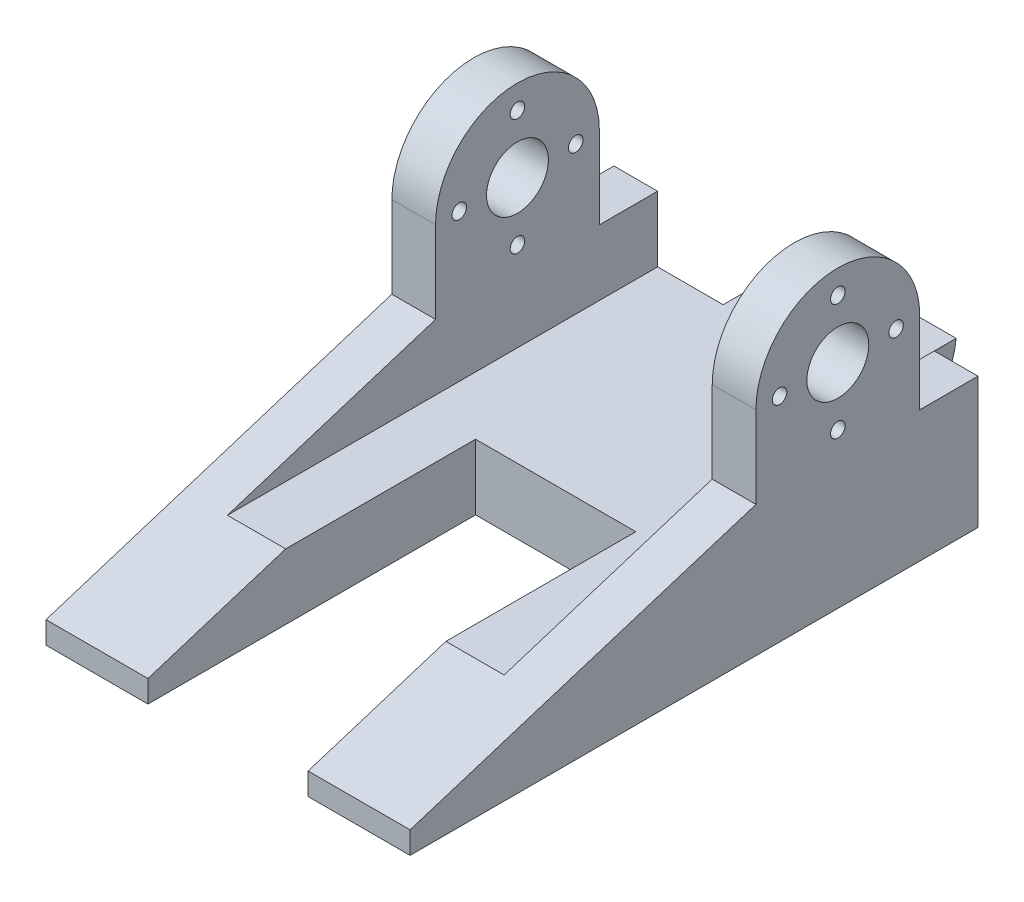
from build123d import *

# Parameters (mm, degrees)
SKETCH1_W           = 50
SKETCH1_H           = 170
BOSS_EXTRUDE1_DEPTH = 55
SKETCH2_W           = 34
SKETCH2_H           = 27
CUT_EXTRUDE1_DEPTH  = 181.416185527
SKETCH3_W           = 10
SKETCH3_H           = 24
SKETCH3_R           = 4.25
SKETCH3_R_2         = 1
CUT_EXTRUDE2_DEPTH  = 186.539753153
SKETCH4_W           = 2
SKETCH4_H           = 24
CUT_EXTRUDE3_DEPTH  = 178.623196683
SKETCH5_W           = 6.25
SKETCH5_H           = 11.25
CUT_EXTRUDE4_DEPTH  = 186.539753153
SKETCH6_W           = 38
SKETCH6_H           = 10
CUT_EXTRUDE5_DEPTH  = 181.416185527
SKETCH8_W           = 13.25
SKETCH8_H           = 2.25
CUT_EXTRUDE7_DEPTH  = 186.539753153
SKETCH9_W           = 34
SKETCH9_H           = 35.25
CUT_EXTRUDE8_DEPTH  = 179.297679458
SKETCH11_W          = 13.25
SKETCH11_H          = 20.25
CUT_EXTRUDE9_DEPTH  = 184.480414486
SKETCH12_W          = 28.5
SKETCH12_H          = 15
BOSS_EXTRUDE2_DEPTH = 8
SKETCH14_W          = 34
SKETCH14_H          = 15
SKETCH14_H_2        = 10.25
BOSS_EXTRUDE3_DEPTH = 13.25
SKETCH16_R          = 4.5
SKETCH16_R_2        = 2.5
CUT_EXTRUDE13_DEPTH = 8
SKETCH17_R          = 4.5
SKETCH17_W          = 55
SKETCH17_H          = 10.25
CUT_EXTRUDE15_DEPTH = 175.384811552
SKETCH18_W          = 71.25
SKETCH18_H          = 27.5
SKETCH18_W_2        = 13.75
SKETCH18_W_3        = 16.25
BOSS_EXTRUDE4_DEPTH = 50
SKETCH19_W          = 38
SKETCH19_H          = 7
CUT_EXTRUDE16_DEPTH = 152.25227271
SKETCH20_W          = 57.5
SKETCH20_H          = 27.5
CUT_EXTRUDE17_DEPTH = 102.137591923
CUT_EXTRUDE18_DEPTH = 100.39221549
SKETCH22_W          = 82.5
SKETCH22_H          = 2.5
BOSS_EXTRUDE5_DEPTH = 50
SKETCH24_W          = 22
SKETCH24_H          = 17
CUT_EXTRUDE19_DEPTH = 101.710289941
SKETCH25_W          = 38
SKETCH25_H          = 38.136363636
CUT_EXTRUDE20_DEPTH = 10
SKETCH27_W          = 38
SKETCH27_H          = 60.136363636
BOSS_EXTRUDE6_DEPTH = 8.6
SKETCH29_W          = 38
SKETCH29_H          = 1.4
CUT_EXTRUDE21_DEPTH = 85.601313414
BOSS_EXTRUDE7_DEPTH = 50
SKETCH31_W          = 38
SKETCH31_H          = 17
CUT_EXTRUDE22_DEPTH = 117.365802537
SKETCH32_W          = 100
SKETCH32_H          = 3
CUT_EXTRUDE23_DEPTH = 101.710289941
SKETCH33_W          = 20
SKETCH33_H          = 10
SKETCH33_W_2        = 22
SKETCH33_H_2        = 45
CUT_EXTRUDE24_DEPTH = 84.137311118
SKETCH34_W          = 8
SKETCH34_H          = 12
CUT_EXTRUDE25_DEPTH = 76.0787087
BOSS_EXTRUDE8_DEPTH = 8
SKETCH37_W          = 78
SKETCH37_H          = 9
SKETCH37_W_2        = 12
CUT_EXTRUDE27_DEPTH = 93.48006542
FILLET1_R           = 10


with BuildPart() as part:
    # Sketch1 → Boss-Extrude1 (new body)
    with BuildSketch(Plane.XY):
        with Locations((0, -85)):
            Rectangle(SKETCH1_W, SKETCH1_H)
    extrude(amount=-BOSS_EXTRUDE1_DEPTH)

    # Sketch2 → Cut-Extrude1 (cut, through all)
    with BuildSketch(Plane.XY):
        with Locations((0, -13.5)):
            Rectangle(SKETCH2_W, SKETCH2_H)
    extrude(amount=-CUT_EXTRUDE1_DEPTH, mode=Mode.SUBTRACT)

    # Sketch3 → Cut-Extrude2 (cut, through all)
    with BuildSketch(Plane(origin=(25, 0, 0), x_dir=(0, 0, -1), z_dir=(1, 0, 0))):
        with Locations((50, -12)):
            Rectangle(SKETCH3_W, SKETCH3_H)
        with Locations((5, -12)):
            Rectangle(SKETCH3_W, SKETCH3_H)
        with Locations(Location((27.5, -12.75, 0), (0, 0, 90))):
            Circle(SKETCH3_R)
        with Locations(Location((35.5, -12.75, 0), (0, 0, 90))):
            Circle(SKETCH3_R_2)
        with Locations(Location((27.5, -4.75, 0), (0, 0, 90))):
            Circle(SKETCH3_R_2)
        with Locations(Location((27.5, -20.75, 0), (0, 0, 90))):
            Circle(SKETCH3_R_2)
        with Locations(Location((19.5, -12.75, 0), (0, 0, 90))):
            Circle(SKETCH3_R_2)
    extrude(amount=-CUT_EXTRUDE2_DEPTH, mode=Mode.SUBTRACT)

    # Sketch4 → Cut-Extrude3 (cut, through all)
    with BuildSketch(Plane.XY.offset(-10)):
        with Locations((-18, -12)):
            Rectangle(SKETCH4_W, SKETCH4_H)
        with Locations((18, -12)):
            Rectangle(SKETCH4_W, SKETCH4_H)
    extrude(amount=-CUT_EXTRUDE3_DEPTH, mode=Mode.SUBTRACT)

    # Sketch5 → Cut-Extrude4 (cut, through all)
    with BuildSketch(Plane(origin=(25, 0, 0), x_dir=(0, 0, -1), z_dir=(1, 0, 0))):
        with BuildLine():
            Line((45, 0), (10, 0))
            Line((10, 0), (10, -12.75))
            Line((10, -12.75), (16.25, -12.75))
            ThreePointArc((16.25, -12.75), (27.5, -1.5), (38.75, -12.75))
            Line((38.75, -12.75), (45, -12.75))
            Line((45, -12.75), (45, 0))
        make_face()
        with Locations((13.125, -18.375)):
            Rectangle(SKETCH5_W, SKETCH5_H)
        with Locations((41.875, -18.375)):
            Rectangle(SKETCH5_W, SKETCH5_H)
    extrude(amount=-CUT_EXTRUDE4_DEPTH, mode=Mode.SUBTRACT)

    # Sketch6 → Cut-Extrude5 (cut, through all)
    with BuildSketch(Plane.XY):
        with Locations((0, -29)):
            Rectangle(SKETCH6_W, SKETCH6_H)
    extrude(amount=-CUT_EXTRUDE5_DEPTH, mode=Mode.SUBTRACT)

    # Sketch8 → Cut-Extrude7 (cut, through all)
    with BuildSketch(Plane(origin=(25, 0, 0), x_dir=(0, 0, -1), z_dir=(1, 0, 0))):
        with BuildLine():
            Line((27.5, -157.5), (27.5, -132.5))
            Line((27.5, -132.5), (13.25, -132.5))
            Line((13.25, -132.5), (13.25, -167.75))
            Line((13.25, -167.75), (17.25, -167.75))
            ThreePointArc((17.25, -167.75), (20.252155493, -160.502155493), (27.5, -157.5))
        make_face()
        with BuildLine():
            Line((41.75, -167.75), (41.75, -132.5))
            Line((41.75, -132.5), (27.5, -132.5))
            Line((27.5, -132.5), (27.5, -157.5))
            ThreePointArc((27.5, -157.5), (34.747844507, -160.502155493), (37.75, -167.75))
            Line((37.75, -167.75), (41.75, -167.75))
        make_face()
        with Locations((48.375, -168.875)):
            Rectangle(SKETCH8_W, SKETCH8_H)
        with Locations((6.625, -168.875)):
            Rectangle(SKETCH8_W, SKETCH8_H)
        with BuildLine():
            Line((17.25, -167.75), (13.25, -167.75))
            Line((13.25, -167.75), (13.25, -170))
            Line((13.25, -170), (17.5, -170))
            ThreePointArc((17.5, -170), (17.31269172, -168.881923142), (17.25, -167.75))
        make_face()
        with BuildLine():
            Line((41.75, -170), (41.75, -167.75))
            Line((41.75, -167.75), (37.75, -167.75))
            ThreePointArc((37.75, -167.75), (37.68730828, -168.881923142), (37.5, -170))
            Line((37.5, -170), (41.75, -170))
        make_face()
        with BuildLine():
            Line((27.5, -167.75), (27.5, -157.5))
            ThreePointArc((27.5, -157.5), (20.252155493, -160.502155493), (17.25, -167.75))
            Line((17.25, -167.75), (27.5, -167.75))
        make_face()
        with BuildLine():
            ThreePointArc((37.75, -167.75), (34.747844507, -160.502155493), (27.5, -157.5))
            Line((27.5, -157.5), (27.5, -167.75))
            Line((27.5, -167.75), (37.75, -167.75))
        make_face()
        with BuildLine():
            Line((27.5, -170), (27.5, -167.75))
            Line((27.5, -167.75), (17.25, -167.75))
            ThreePointArc((17.25, -167.75), (17.31269172, -168.881923142), (17.5, -170))
            Line((17.5, -170), (27.5, -170))
        make_face()
        with BuildLine():
            ThreePointArc((37.5, -170), (37.68730828, -168.881923142), (37.75, -167.75))
            Line((37.75, -167.75), (27.5, -167.75))
            Line((27.5, -167.75), (27.5, -170))
            Line((27.5, -170), (37.5, -170))
        make_face()
    extrude(amount=-CUT_EXTRUDE7_DEPTH, mode=Mode.SUBTRACT)

    # Sketch9 → Cut-Extrude8 (cut, through all)
    with BuildSketch(Plane.XY):
        with Locations((0, -150.125)):
            Rectangle(SKETCH9_W, SKETCH9_H)
    extrude(amount=-CUT_EXTRUDE8_DEPTH, mode=Mode.SUBTRACT)

    # Sketch11 → Cut-Extrude9 (cut, through all)
    with BuildSketch(Plane(origin=(25, 0, 0), x_dir=(0, 0, -1), z_dir=(1, 0, 0))):
        with BuildLine():
            ThreePointArc((17.25, -167.75), (20.252155493, -160.502155493), (27.5, -157.5))
            Line((27.5, -157.5), (27.5, -147.5))
            Line((27.5, -147.5), (13.25, -147.5))
            Line((13.25, -147.5), (13.25, -167.75))
            Line((13.25, -167.75), (17.25, -167.75))
        make_face()
        with BuildLine():
            Line((27.5, -147.5), (27.5, -157.5))
            ThreePointArc((27.5, -157.5), (34.747844507, -160.502155493), (37.75, -167.75))
            Line((37.75, -167.75), (41.75, -167.75))
            Line((41.75, -167.75), (41.75, -147.5))
            Line((41.75, -147.5), (27.5, -147.5))
        make_face()
        with Locations((48.375, -157.625)):
            Rectangle(SKETCH11_W, SKETCH11_H)
        with Locations((6.625, -157.625)):
            Rectangle(SKETCH11_W, SKETCH11_H)
    extrude(amount=-CUT_EXTRUDE9_DEPTH, mode=Mode.SUBTRACT)

    # Sketch12 → Boss-Extrude2 (add)
    with BuildSketch(Plane(origin=(25, 0, 0), x_dir=(0, 0, -1), z_dir=(1, 0, 0))):
        with Locations((27.5, -140)):
            Rectangle(SKETCH12_W, SKETCH12_H)
    boss_extrude2 = extrude(amount=-BOSS_EXTRUDE2_DEPTH)

    # Mirror1: Boss-Extrude2 across plane
    add(boss_extrude2.mirror(Plane(origin=(0, 0, 0), x_dir=(0, 0, 1), z_dir=(1, 0, 0))))

    # Sketch14 → Boss-Extrude3 (add)
    with BuildSketch(Plane.XY):
        with Locations((0, -140)):
            Rectangle(SKETCH14_W, SKETCH14_H)
        with Locations((0, -152.625)):
            Rectangle(SKETCH14_W, SKETCH14_H_2)
    boss_extrude3 = extrude(amount=-BOSS_EXTRUDE3_DEPTH)

    # Mirror2: Boss-Extrude3 across plane
    add(boss_extrude3.mirror(Plane.XY.offset(-27.5)))

    # Sketch16 → Cut-Extrude13 (cut)
    # profile 1 of 3: a face of its own
    with BuildSketch(Plane(origin=(25, 0, 0), x_dir=(0, 0, -1), z_dir=(1, 0, 0))):
        with Locations(Location((16.5, -135.75, 0), (0, 0, 90))):
            Circle(SKETCH16_R)
        with Locations((16.5, -135.75)):
            Circle(SKETCH16_R_2, mode=Mode.SUBTRACT)
    # profile 2 of 3: a face of its own
    with BuildSketch(Plane(origin=(25, 0, 0), x_dir=(0, 0, -1), z_dir=(1, 0, 0))):
        with Locations((16.5, -135.75)):
            Circle(SKETCH16_R_2)
    # profile 3 of 3: a face of its own
    with BuildSketch(Plane(origin=(25, 0, 0), x_dir=(0, 0, -1), z_dir=(1, 0, 0))):
        with Locations(Location((38.5, -135.75, 0), (0, 0, 90))):
            Circle(SKETCH16_R)
    cut_extrude13 = extrude(amount=-CUT_EXTRUDE13_DEPTH, mode=Mode.SUBTRACT)

    # Mirror3: Cut-Extrude13 across plane
    add(cut_extrude13.mirror(Plane(origin=(0, 0, 0), x_dir=(0, 0, 1), z_dir=(1, 0, 0))), mode=Mode.SUBTRACT)

    # Sketch17 → Cut-Extrude15 (cut, through all)
    # profile 1 of 4: a face of its own
    with BuildSketch(Plane(origin=(25, 0, 0), x_dir=(0, 0, -1), z_dir=(1, 0, 0))):
        Polygon((55, -51.5), (27.5, -51.5), (0, -51.5), (0, -147.5), (55, -147.5), align=None)
        with Locations((16.5, -135.75)):
            Circle(SKETCH17_R, mode=Mode.SUBTRACT)
        with Locations((38.5, -135.75)):
            Circle(SKETCH17_R, mode=Mode.SUBTRACT)
    # profile 2 of 4: a face of its own
    with BuildSketch(Plane(origin=(25, 0, 0), x_dir=(0, 0, -1), z_dir=(1, 0, 0))):
        with Locations((27.5, -152.625)):
            Rectangle(SKETCH17_W, SKETCH17_H)
    # profile 3 of 4: a face of its own
    with BuildSketch(Plane(origin=(25, 0, 0), x_dir=(0, 0, -1), z_dir=(1, 0, 0))):
        with Locations((38.5, -135.75)):
            Circle(SKETCH17_R)
    # profile 4 of 4: a face of its own
    with BuildSketch(Plane(origin=(25, 0, 0), x_dir=(0, 0, -1), z_dir=(1, 0, 0))):
        with Locations((16.5, -135.75)):
            Circle(SKETCH17_R)
    extrude(amount=-CUT_EXTRUDE15_DEPTH, mode=Mode.SUBTRACT)

    # Sketch18 → Boss-Extrude4 (add)
    with BuildSketch(Plane(origin=(25, 0, 0), x_dir=(0, 0, -1), z_dir=(1, 0, 0))):
        with Locations((-35.625, -37.75)):
            Rectangle(SKETCH18_W, SKETCH18_H)
        with Locations((61.875, -37.75)):
            Rectangle(SKETCH18_W_2, SKETCH18_H)
        Polygon((38.75, -51.5), (38.75, -24), (16.25, -24), (0, -24), (0, -51.5), align=None)
        with Locations((46.875, -37.75)):
            Rectangle(SKETCH18_W_3, SKETCH18_H)
    extrude(amount=-BOSS_EXTRUDE4_DEPTH)

    # Sketch19 → Cut-Extrude16 (cut, through all)
    with BuildSketch(Plane.XY.offset(71.25)):
        with Locations((0, -27.5)):
            Rectangle(SKETCH19_W, SKETCH19_H)
    extrude(amount=-CUT_EXTRUDE16_DEPTH, mode=Mode.SUBTRACT)

    # Sketch20 → Cut-Extrude17 (cut, through all)
    with BuildSketch(Plane(origin=(25, 0, 0), x_dir=(0, 0, -1), z_dir=(1, 0, 0))):
        with Locations((-42.5, -37.75)):
            Rectangle(SKETCH20_W, SKETCH20_H)
    extrude(amount=-CUT_EXTRUDE17_DEPTH, mode=Mode.SUBTRACT)

    # Sketch21 → Cut-Extrude18 (cut, through all)
    with BuildSketch(Plane(origin=(25, 0, 0), x_dir=(0, 0, -1), z_dir=(1, 0, 0))):
        Polygon((16.25, -24), (-13.75, -51.5), (-13.75, -24), align=None)
    extrude(amount=-CUT_EXTRUDE18_DEPTH, mode=Mode.SUBTRACT)

    # Sketch22 → Boss-Extrude5 (add)
    with BuildSketch(Plane(origin=(25, 0, 0), x_dir=(0, 0, -1), z_dir=(1, 0, 0))):
        with Locations((27.5, -52.75)):
            Rectangle(SKETCH22_W, SKETCH22_H)
    extrude(amount=-BOSS_EXTRUDE5_DEPTH)

    # Sketch24 → Cut-Extrude19 (cut, through all)
    with BuildSketch(Plane(origin=(25, 0, 0), x_dir=(0, 0, -1), z_dir=(1, 0, 0))):
        with Locations((57.75, -32.5)):
            Rectangle(SKETCH24_W, SKETCH24_H)
    extrude(amount=-CUT_EXTRUDE19_DEPTH, mode=Mode.SUBTRACT)

    # Sketch25 → Cut-Extrude20 (cut)
    with BuildSketch(Plane(origin=(0, -31, 0), x_dir=(1, 0, 0), z_dir=(0, 1, 0))):
        with Locations((0, 27.681818182)):
            Rectangle(SKETCH25_W, SKETCH25_H)
    extrude(amount=-CUT_EXTRUDE20_DEPTH, mode=Mode.SUBTRACT)

    # Sketch27 → Boss-Extrude6 (add)
    with BuildSketch(Plane(origin=(0, -41, 0), x_dir=(1, 0, 0), z_dir=(0, 1, 0))):
        with Locations((0, 38.681818182)):
            Rectangle(SKETCH27_W, SKETCH27_H)
    extrude(amount=BOSS_EXTRUDE6_DEPTH)

    # Sketch29 → Cut-Extrude21 (cut, through all)
    with BuildSketch(Plane(origin=(0, 0, -8.613636364), x_dir=(-1, 0, 0), z_dir=(0, 0, -1))):
        with Locations((0, -31.7)):
            Rectangle(SKETCH29_W, SKETCH29_H)
    extrude(amount=-CUT_EXTRUDE21_DEPTH, mode=Mode.SUBTRACT)

    # Sketch30 → Boss-Extrude7 (add)
    with BuildSketch(Plane.ZY.offset(25)):
        Polygon((31.25, -38.957214173), (-16.25, -24), (-7.086363636, -32.4), (13.75, -51.5), (13.75, -53.914428346), (31.25, -53.914428346), align=None)
        Polygon((-16.25, -24), (-16.25, -32.4), (-7.086363636, -32.4), align=None)
    extrude(amount=-BOSS_EXTRUDE7_DEPTH)

    # Sketch31 → Cut-Extrude22 (cut, through all)
    with BuildSketch(Plane(origin=(0, 0, -68.75), x_dir=(-1, 0, 0), z_dir=(0, 0, -1))):
        with Locations((0, -32.5)):
            Rectangle(SKETCH31_W, SKETCH31_H)
    extrude(amount=-CUT_EXTRUDE22_DEPTH, mode=Mode.SUBTRACT)

    # Sketch32 → Cut-Extrude23 (cut, through all)
    with BuildSketch(Plane(origin=(25, 0, 0), x_dir=(0, 0, -1), z_dir=(1, 0, 0))):
        with Locations((18.75, -52.5)):
            Rectangle(SKETCH32_W, SKETCH32_H)
    extrude(amount=-CUT_EXTRUDE23_DEPTH, mode=Mode.SUBTRACT)

    # Sketch33 → Cut-Extrude24 (cut, through all)
    with BuildSketch(Plane(origin=(0, -41, 0), x_dir=(1, 0, 0), z_dir=(0, 1, 0))):
        Polygon((-10, 68.75), (-25, 68.75), (-25, 46.75), (-19, 46.75), (-10, 46.75), (-10, 58.75), align=None)
        Polygon((25, 68.75), (10, 68.75), (10, 58.75), (10, 46.75), (19, 46.75), (25, 46.75), align=None)
        with Locations((0, 63.75)):
            Rectangle(SKETCH33_W, SKETCH33_H)
        with Locations((0, -8.75)):
            Rectangle(SKETCH33_W_2, SKETCH33_H_2)
    extrude(amount=-CUT_EXTRUDE24_DEPTH, mode=Mode.SUBTRACT)

    # Sketch34 → Cut-Extrude25 (cut, through all)
    with BuildSketch(Plane(origin=(0, -41, 0), x_dir=(1, 0, 0), z_dir=(0, 1, 0))):
        with Locations((0, 52.75)):
            Rectangle(SKETCH34_W, SKETCH34_H)
    extrude(amount=-CUT_EXTRUDE25_DEPTH, mode=Mode.SUBTRACT)

    # Sketch36 → Boss-Extrude8 (add)
    with BuildSketch(Plane(origin=(0, -41, 0), x_dir=(1, 0, 0), z_dir=(0, 1, 0))):
        Polygon((4, 58.75), (4, 46.75), (-4, 46.75), (-4, 58.75), (-10, 58.75), (-10, 46.75), (-19, 46.75), (-19, -31.25), (-11, -31.25), (-11, 13.75), (11, 13.75), (11, -31.25), (19, -31.25), (19, 46.75), (10, 46.75), (10, 58.75), align=None)
    extrude(amount=BOSS_EXTRUDE8_DEPTH)

    # Sketch37 → Cut-Extrude27 (cut, through all)
    with BuildSketch(Plane(origin=(25, 0, 0), x_dir=(0, 0, -1), z_dir=(1, 0, 0))):
        with Locations((7.75, -46.5)):
            Rectangle(SKETCH37_W, SKETCH37_H)
        Polygon((-31.25, -33), (-31.25, -38.957214173), (-12.331525614, -33), align=None)
        with Locations((52.75, -46.5)):
            Rectangle(SKETCH37_W_2, SKETCH37_H)
    extrude(amount=-CUT_EXTRUDE27_DEPTH, mode=Mode.SUBTRACT)

    # Fillet1
    # the kernel refuses this fillet: 10 mm, written as the material it takes off along each edge
    with BuildSketch(Plane(origin=(20.874685928, -42, -58.75), x_dir=(0, 0, 1), z_dir=(-1, 0, 0)), Plane(origin=(34.874685928, -42, -58.75), x_dir=(0, 0, 1), z_dir=(-1, 0, 0))) as fillet1_piece_1:
        with BuildLine():
            CenterArc((9.949874371, 10), FILLET1_R, 185.739170477, 84.260829523)
            Line((0, 9), (-0.198997487, 8.98))
            ThreePointArc((-0.198997487, 8.98), (-0.2, 4.5), (-0.2, 0))
            Line((-0.2, 0), (0, -0.2))
            Line((0, -0.2), (9.949874371, -0.2))
            Line((9.949874371, -0.2), (9.949874371, 0))
        make_face()
    extrude(amount=55.749371855, mode=Mode.SUBTRACT)


solid = part.part
